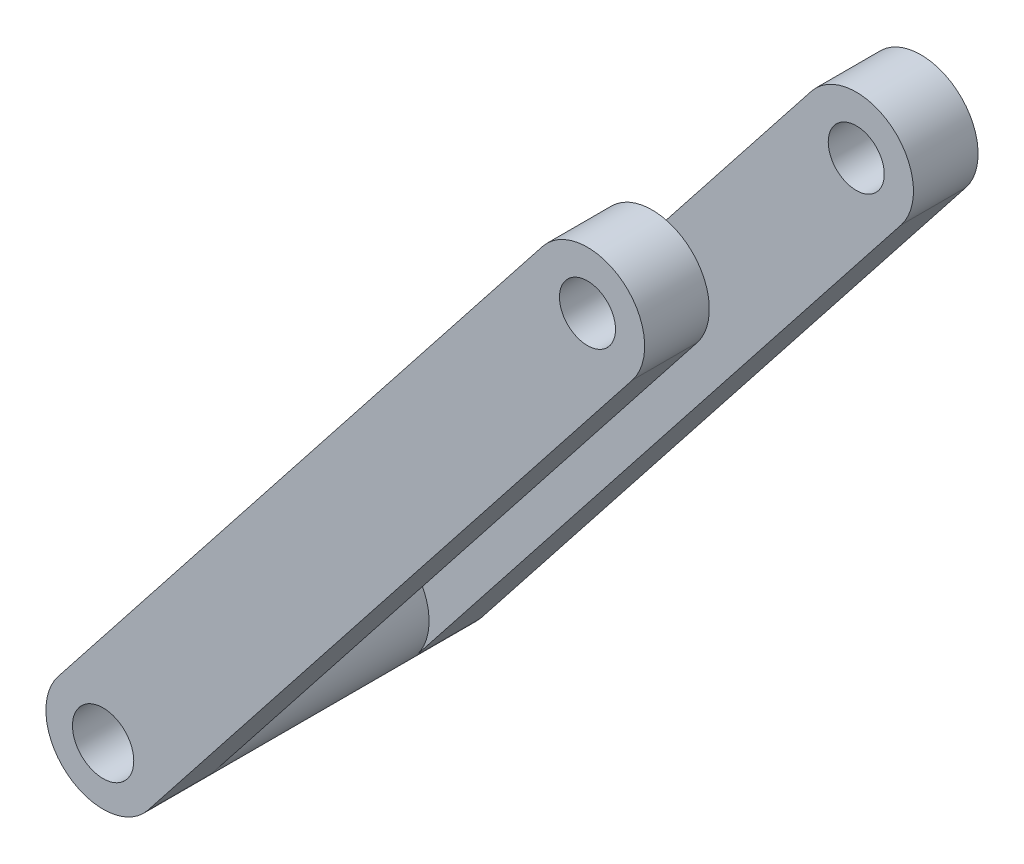
from build123d import *

# Parameters (mm, degrees)
SALIENTE_EXTRUIR1_START       = 0.2
SALIENTE_EXTRUIR1_OUTLINE_R   = 1.802094284
SALIENTE_EXTRUIR1_OUTLINE_R_2 = 1.64762906
SALIENTE_EXTRUIR1_DEPTH       = 3.8
CROQUIS2_R                    = 3.36248758
CROQUIS2_R_2                  = 1.8
SALIENTE_EXTRUIR2_DEPTH       = 6
SIMETR_A5_COPY_1_SKETCH_R     = 3.36248758
SIMETR_A5_COPY_1_SKETCH_R_2   = 1.8
SIMETR_A5_COPY_1_DEPTH        = 6
SIMETR_A5_COPY_2_SKETCH_R     = 3.36248758
SIMETR_A5_COPY_2_SKETCH_R_2   = 1.8
SIMETR_A5_COPY_2_DEPTH        = 6


# Read off the part's stored shape, not the designer's step: Saliente-Extruir1
with BuildPart() as part:
    # Saliente-Extruir1 outline → Saliente-Extruir1 (new body)
    with BuildSketch(Plane.XY.offset(SALIENTE_EXTRUIR1_START)):
        with BuildLine():
            Line((57.990889124, -9.110899758), (86.465185089, 27.016852307))
            ThreePointArc((86.465185089, 27.016852307), (85.905736152, 31.739104142), (81.183484317, 31.179655205))
            Line((81.183484317, 31.179655205), (52.709188351, -4.94809686))
            ThreePointArc((52.709188351, -4.94809686), (53.268637289, -9.670348695), (57.990889124, -9.110899758))
        make_face()
        with Locations((55.350038738, -7.029498309)):
            Circle(SALIENTE_EXTRUIR1_OUTLINE_R, mode=Mode.SUBTRACT)
        with Locations((83.824334703, 29.098253756)):
            Circle(SALIENTE_EXTRUIR1_OUTLINE_R_2, mode=Mode.SUBTRACT)
    saliente_extruir1 = extrude(amount=SALIENTE_EXTRUIR1_DEPTH)

    # Croquis2 → Saliente-Extruir2 (add)
    with BuildSketch(Plane.XY.offset(4)):
        with Locations(Location((55.350038738, -7.029498309, 0), (0, 0, 141.756384729))):
            Circle(CROQUIS2_R)
        with Locations((55.350038738, -7.029498309)):
            Circle(CROQUIS2_R_2, mode=Mode.SUBTRACT)
    saliente_extruir2 = extrude(amount=SALIENTE_EXTRUIR2_DEPTH)

    # Simetría4: Saliente-Extruir2 across plane
    add(saliente_extruir2.mirror(Plane.XY.offset(10)))

    # Simetría5: Saliente-Extruir1 across plane
    add(saliente_extruir1.mirror(Plane.XY.offset(10)))

    # Simetría5 copy 1 sketch → Simetría5 copy 1 (add)
    with BuildSketch(Plane.XY.offset(4)):
        with Locations(Location((55.350038738, -7.029498309, 0), (0, 0, 141.756384729))):
            Circle(SIMETR_A5_COPY_1_SKETCH_R)
        with Locations((55.350038738, -7.029498309)):
            Circle(SIMETR_A5_COPY_1_SKETCH_R_2, mode=Mode.SUBTRACT)
    extrude(amount=SIMETR_A5_COPY_1_DEPTH)

    # Simetría5 copy 2 sketch → Simetría5 copy 2 (add)
    with BuildSketch(Plane(origin=(0, 0, 16), x_dir=(1, 0, 0), z_dir=(0, 0, -1))):
        with Locations((55.350038738, 7.029498309)):
            Circle(SIMETR_A5_COPY_2_SKETCH_R)
        with Locations((55.350038738, 7.029498309)):
            Circle(SIMETR_A5_COPY_2_SKETCH_R_2, mode=Mode.SUBTRACT)
    extrude(amount=SIMETR_A5_COPY_2_DEPTH)


solid = part.part
